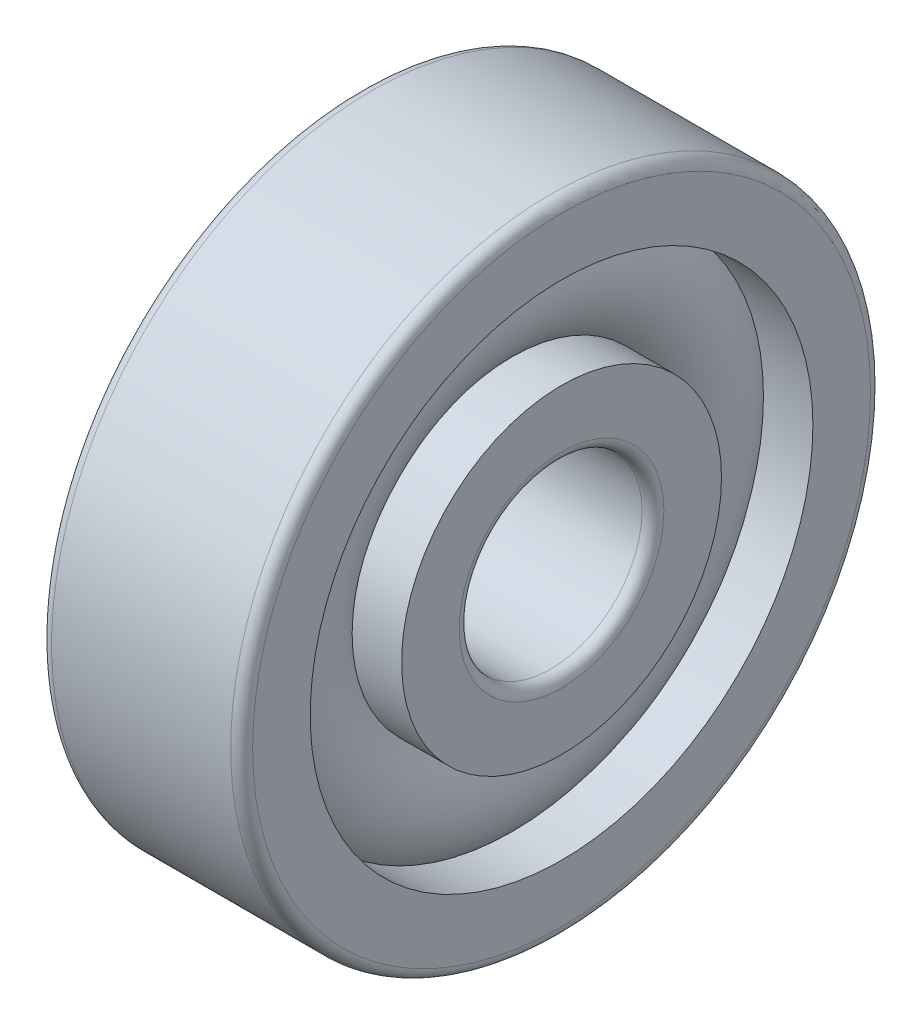
from build123d import *

# Parameters (mm, degrees)
CAGSPISKE_W     = 0.75
CAGSPISKE_H     = 1.25
CAGESPINE_ANGLE = 0.001
BALSIMSKE_R     = 3.75


with BuildPart() as part:
    # CagSpiSke → CageSpine (revolve)
    with BuildSketch(Plane.XY):
        with Locations((0, 11.25)):
            Rectangle(CAGSPISKE_W, CAGSPISKE_H)
    revolve(axis=Axis((-20.6375, 0, 0), (-1, 0, 0)), revolution_arc=CAGESPINE_ANGLE)

    # BalSimSke → BallsSimplified (revolve)
    with BuildSketch(Plane.XY):
        with Locations((0, 11.25)):
            Circle(BALSIMSKE_R)
    revolve(axis=Axis((-10, 0, 0), (1, 0, 0)))

    # InnRacSke → InnerRace (revolve)
    with BuildSketch(Plane.XY):
        with BuildLine():
            Line((-2.761453422, 8.75), (-5.5, 8.75))
            Line((-5.5, 8.75), (-5.5, 5.6))
            ThreePointArc((-5.5, 5.6), (-5.324264069, 5.175735931), (-4.9, 5))
            Line((-4.9, 5), (4.9, 5))
            ThreePointArc((4.9, 5), (5.324264069, 5.175735931), (5.5, 5.6))
            Line((5.5, 5.6), (5.5, 8.75))
            Line((5.5, 8.75), (2.761453422, 8.75))
            ThreePointArc((2.761453422, 8.75), (0, 7.525), (-2.761453422, 8.75))
        make_face()
    revolve(axis=Axis((-20.6375, 0, 0), (1, 0, 0)))

    # OutRacSke → OuterRace (revolve)
    with BuildSketch(Plane.XY):
        with BuildLine():
            Line((-2.761453422, 13.75), (-5.5, 13.75))
            Line((-5.5, 13.75), (-5.5, 16.9))
            ThreePointArc((-5.5, 16.9), (-5.324264069, 17.324264069), (-4.9, 17.5))
            Line((-4.9, 17.5), (4.9, 17.5))
            ThreePointArc((4.9, 17.5), (5.324264069, 17.324264069), (5.5, 16.9))
            Line((5.5, 16.9), (5.5, 13.75))
            Line((5.5, 13.75), (2.761453422, 13.75))
            ThreePointArc((2.761453422, 13.75), (0, 14.975), (-2.761453422, 13.75))
        make_face()
    revolve(axis=Axis((-20.6375, 0, 0), (1, 0, 0)))


solid = part.part
